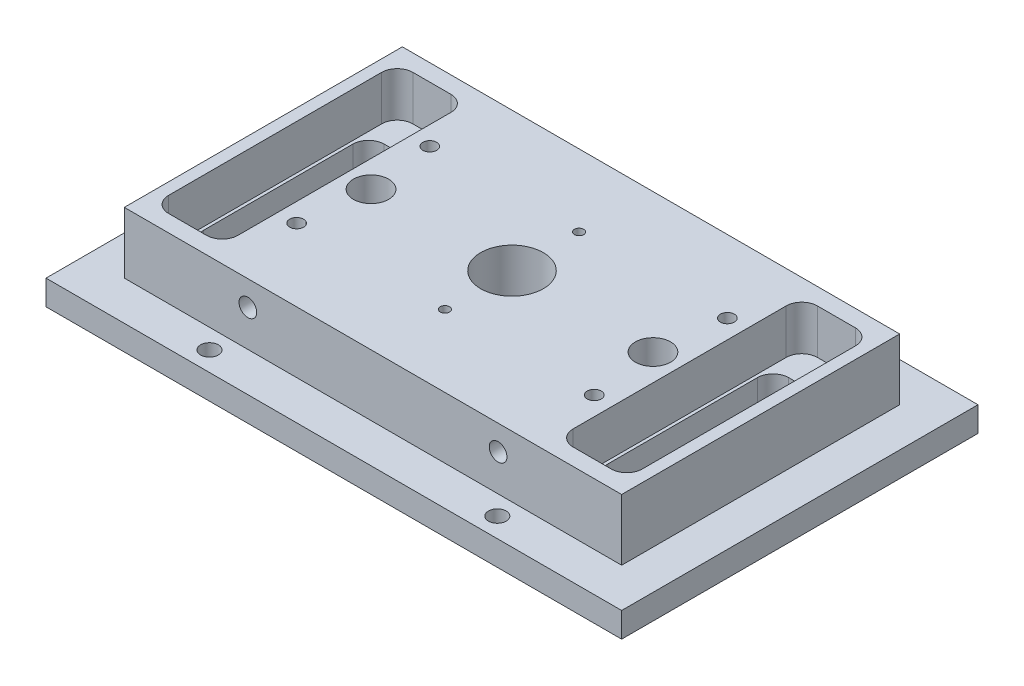
from build123d import *

# Parameters (mm, degrees)
MAIN_SKETCH_W                         = 73.5
MAIN_SKETCH_H                         = 45.5
MAIN_SKETCH_W_2                       = 8.85
MAIN_SKETCH_H_2                       = 31.2
MAIN_SKETCH_R                         = 2.2479
LIP_DEPTH                             = 3.175
MOUNTING_BASE_OUTLINE_W               = 63.5
MOUNTING_BASE_OUTLINE_H               = 35.5
MOUNTING_BASE_OUTLINE_R               = 2.2479
MOUNTING_BASE_OUTLINE_R_2             = 4
MOUNTING_BASE_DEPTH                   = 11
HEATER_CART_4_40_TAPS_D               = 2.2606
HEATER_CART_4_40_TAPS_DEPTH           = 7.595
HEATER_CART_4_40_TAPS_TIP             = 0.679152758
HEATER_CART_4_40_TAPS_ON_FACE_2_D     = 2.2606
HEATER_CART_4_40_TAPS_ON_FACE_2_DEPTH = 7.595
HEATER_CART_4_40_TAPS_ON_FACE_2_TIP   = 0.679152758
MAIN_SKETCH_12_W                      = 8.85
MAIN_SKETCH_12_H                      = 31.2
MAIN_SKETCH_12_R                      = 0.285
BOTTOM_SQUARE_CUTOUT_DEPTH            = 2
SQUARE_MICRO_D_CUTOUT_START           = 5.3
SQUARE_MICRO_D_CUTOUT_OUTLINE_W       = 8.85
SQUARE_MICRO_D_CUTOUT_OUTLINE_H       = 31.2
SQUARE_MICRO_D_CUTOUT_OUTLINE_R       = 0.285
SQUARE_MICRO_D_CUTOUT_DEPTH           = 5.7
SKETCH15_W                            = 8.067488146
SKETCH15_H                            = 23.070933647
CUT_EXTRUDE1_DEPTH                    = 11
INTERNAL_CORNER_CUTOUTS_FILLET_R      = 2
CHIP_CLAMP_0_80_TAPS_AT_2_COUNT       = 2
CHIP_CLAMP_0_80_TAPS_AT_2_PITCH       = 17.1232
CHIP_CLAMP_0_80_TAPS_AT_3_COUNT       = 2
CHIP_CLAMP_0_80_TAPS_AT_3_PITCH       = 17.1232
F_2_56_CLOSE_CLEAR_43_0_089_D         = 2.2606
PCB_2_56_TAPS_D                       = 1.778
PCB_2_56_TAPS_DEPTH                   = 5.734
PCB_2_56_TAPS_TIP                     = 0.53416509
BOTTOM_COVER_2_56_TAPS_D              = 1.778
BOTTOM_COVER_2_56_TAPS_DEPTH          = 5.734
BOTTOM_COVER_2_56_TAPS_TIP            = 0.53416509
F_2_56_TAPPED_HOLE1_D                 = 1.778
F_2_56_TAPPED_HOLE1_DEPTH             = 5.734
F_2_56_TAPPED_HOLE1_TIP               = 0.53416509


# Read off the part's stored shape, not the designer's step: Mounting_Base, Square_Micro_D_Cutout
with BuildPart() as part:
    # Main_Sketch → Lip (new body)
    with BuildSketch(Plane(origin=(0, 0, 0), x_dir=(1, 0, 0), z_dir=(0, 1, 0))):
        with Locations((36.75, -22.75)):
            Rectangle(MAIN_SKETCH_W, MAIN_SKETCH_H)
        with Locations((10.925, -22.749999985)):
            Rectangle(MAIN_SKETCH_W_2, MAIN_SKETCH_H_2, mode=Mode.SUBTRACT)
        with Locations(Location((18.75, -22.75, 0), (0, 0, 270))):
            Circle(MAIN_SKETCH_R, mode=Mode.SUBTRACT)
        with BuildLine():
            ThreePointArc((31.675, -20.175), (29.907233047, -15.907233047), (34.175, -17.675))
            Line((34.175, -17.675), (39.325, -17.675))
            ThreePointArc((39.325, -17.675), (43.592766953, -15.907233047), (41.825, -20.175))
            Line((41.825, -20.175), (41.825, -25.325))
            ThreePointArc((41.825, -25.325), (43.592766953, -29.592766953), (39.325, -27.825))
            Line((39.325, -27.825), (34.175, -27.825))
            ThreePointArc((34.175, -27.825), (29.907233047, -29.592766953), (31.675, -25.325))
            Line((31.675, -25.325), (31.675, -20.175))
        make_face(mode=Mode.SUBTRACT)
        with Locations(Location((54.75, -22.75, 0), (0, 0, 270))):
            Circle(MAIN_SKETCH_R, mode=Mode.SUBTRACT)
    extrude(amount=LIP_DEPTH)

    # Mounting_Base outline → Mounting_Base (add)
    with BuildSketch(Plane(origin=(0, 0, 0), x_dir=(1, 0, 0), z_dir=(0, 1, 0))):
        with Locations((36.75, -22.75)):
            Rectangle(MOUNTING_BASE_OUTLINE_W, MOUNTING_BASE_OUTLINE_H)
        with Locations((18.75, -22.75)):
            Circle(MOUNTING_BASE_OUTLINE_R, mode=Mode.SUBTRACT)
        with Locations((54.75, -22.75)):
            Circle(MOUNTING_BASE_OUTLINE_R, mode=Mode.SUBTRACT)
        with Locations((36.75, -22.75)):
            Circle(MOUNTING_BASE_OUTLINE_R_2, mode=Mode.SUBTRACT)
    extrude(amount=MOUNTING_BASE_DEPTH)

    # Heater_Cart_#4-40_Taps
    with Locations(Plane(origin=(52.725, 7.825, 5), x_dir=(-1, 0, 0), z_dir=(0, 0, -1))):
        with Locations((0, 0), (31.95, 0)):
            Hole(HEATER_CART_4_40_TAPS_D / 2, depth=HEATER_CART_4_40_TAPS_DEPTH)
            with Locations((0, 0, -(HEATER_CART_4_40_TAPS_DEPTH + HEATER_CART_4_40_TAPS_TIP / 2))):  # 118° drill point
                Cone(0, HEATER_CART_4_40_TAPS_D / 2, HEATER_CART_4_40_TAPS_TIP, mode=Mode.SUBTRACT)

    # Heater_Cart_#4-40_Taps on face 2
    with Locations(Plane(origin=(20.775, 7.825, 40.5), x_dir=(1, 0, 0), z_dir=(0, 0, 1))):
        with Locations((0, 0), (31.95, 0)):
            Hole(HEATER_CART_4_40_TAPS_ON_FACE_2_D / 2, depth=HEATER_CART_4_40_TAPS_ON_FACE_2_DEPTH)
            with Locations((0, 0, -(HEATER_CART_4_40_TAPS_ON_FACE_2_DEPTH + HEATER_CART_4_40_TAPS_ON_FACE_2_TIP / 2))):  # 118° drill point
                Cone(0, HEATER_CART_4_40_TAPS_ON_FACE_2_D / 2, HEATER_CART_4_40_TAPS_ON_FACE_2_TIP, mode=Mode.SUBTRACT)

    # Main_Sketch<12> → Bottom_square_cutout (cut)
    # profile 1 of 2: a face of its own
    with BuildSketch(Plane(origin=(0, 0, 0), x_dir=(1, 0, 0), z_dir=(0, 1, 0))):
        with Locations((10.925, -22.749999985)):
            Rectangle(MAIN_SKETCH_12_W, MAIN_SKETCH_12_H)
        with BuildLine():
            ThreePointArc((10.385689992, -35.285466808), (9.155254643, -35.471894814), (7.986136174, -35.045410869))
            ThreePointArc((7.986136174, -35.045410869), (7.18175843, -34.143309058), (6.891255927, -32.970099985))
            Line((6.891255927, -32.970099985), (6.891255927, -12.529899985))
            ThreePointArc((6.891255927, -12.529899985), (7.18175845, -11.356690961), (7.986136174, -10.454589189))
            ThreePointArc((7.986136174, -10.454589189), (9.155254643, -10.028105244), (10.385689992, -10.21453325))
            Line((10.385689992, -10.21453325), (13.424612074, -11.500982853))
            ThreePointArc((13.424612074, -11.500982853), (14.540409069, -12.427601581), (14.958744073, -13.816349588))
            Line((14.958744073, -13.816349588), (14.958744073, -31.683650456))
            ThreePointArc((14.958744073, -31.683650456), (14.540409073, -33.072398471), (13.424612074, -33.999017205))
            Line((13.424612074, -33.999017205), (10.385689992, -35.285466808))
        make_face(mode=Mode.SUBTRACT)
    # profile 2 of 2: a face of its own
    with BuildSketch(Plane(origin=(0, 0, 0), x_dir=(1, 0, 0), z_dir=(0, 1, 0))):
        with BuildLine():
            ThreePointArc((7.986136174, -35.045410869), (7.18175843, -34.143309058), (6.891255927, -32.970099985))
            Line((6.891255927, -32.970099985), (6.891255927, -12.529899985))
            ThreePointArc((6.891255927, -12.529899985), (7.18175845, -11.356690961), (7.986136174, -10.454589189))
            ThreePointArc((7.986136174, -10.454589189), (9.155254643, -10.028105244), (10.385689992, -10.21453325))
            Line((10.385689992, -10.21453325), (13.424612074, -11.500982853))
            ThreePointArc((13.424612074, -11.500982853), (14.540409069, -12.427601581), (14.958744073, -13.816349588))
            Line((14.958744073, -13.816349588), (14.958744073, -31.683650456))
            ThreePointArc((14.958744073, -31.683650456), (14.540409073, -33.072398471), (13.424612074, -33.999017205))
            Line((13.424612074, -33.999017205), (10.385689992, -35.285466808))
            ThreePointArc((10.385689992, -35.285466808), (9.155254643, -35.471894814), (7.986136174, -35.045410869))
        make_face()
        with Locations(Location((10.239255927, -22.75, 0), (0, 0, 270))):
            Circle(MAIN_SKETCH_12_R, mode=Mode.SUBTRACT)
    bottom_square_cutout = extrude(amount=BOTTOM_SQUARE_CUTOUT_DEPTH, mode=Mode.SUBTRACT)

    # Square_Micro_D_Cutout outline → Square_Micro_D_Cutout (cut)
    with BuildSketch(Plane(origin=(0, 0, 0), x_dir=(1, 0, 0), z_dir=(0, 1, 0)).offset(SQUARE_MICRO_D_CUTOUT_START)):
        with Locations((10.925, -22.749999985)):
            Rectangle(SQUARE_MICRO_D_CUTOUT_OUTLINE_W, SQUARE_MICRO_D_CUTOUT_OUTLINE_H)
        with Locations((10.239255927, -22.75)):
            Circle(SQUARE_MICRO_D_CUTOUT_OUTLINE_R, mode=Mode.SUBTRACT)
    square_micro_d_cutout = extrude(amount=SQUARE_MICRO_D_CUTOUT_DEPTH, mode=Mode.SUBTRACT)

    # Sketch15 → Cut-Extrude1 (cut)
    with BuildSketch(Plane(origin=(0, 0, 0), x_dir=(1, 0, 0), z_dir=(0, 1, 0))):
        with Locations((10.925, -22.749999985)):
            Rectangle(SKETCH15_W, SKETCH15_H)
    cut_extrude1 = extrude(amount=CUT_EXTRUDE1_DEPTH, mode=Mode.SUBTRACT)

    # MicroD_Mirror: Bottom_square_cutout, Square_Micro_D_Cutout, Cut-Extrude1 across plane
    add(bottom_square_cutout.mirror(Plane(origin=(36.75, 0, 0), x_dir=(0, 0, 1), z_dir=(1, 0, 0))), mode=Mode.SUBTRACT)
    add(square_micro_d_cutout.mirror(Plane(origin=(36.75, 0, 0), x_dir=(0, 0, 1), z_dir=(1, 0, 0))), mode=Mode.SUBTRACT)
    add(cut_extrude1.mirror(Plane(origin=(36.75, 0, 0), x_dir=(0, 0, 1), z_dir=(1, 0, 0))), mode=Mode.SUBTRACT)

    # Internal_Corner_cutouts_fillet
    internal_corner_cutouts_fillet_edges = [part.edges().sort_by_distance(p)[0] for p in [
        (15.35, 1, 38.349999985),
        (15.35, 1, 7.149999985),
        (6.5, 1, 7.149999985),
        (6.5, 1, 38.349999985),
        (15.35, 8.15, 38.349999985),
        (6.5, 8.15, 38.349999985),
        (6.5, 8.15, 7.149999985),
        (15.35, 8.15, 7.149999985),
        (14.958744073, 3.65, 34.285466808),
        (14.958744073, 3.65, 11.214533161),
        (6.891255927, 3.65, 11.214533161),
        (6.891255927, 3.65, 34.285466808),
        (58.15, 1, 7.149999985),
        (58.15, 1, 38.349999985),
        (67, 1, 38.349999985),
        (67, 1, 7.149999985),
        (67, 8.15, 7.149999985),
        (67, 8.15, 38.349999985),
        (58.15, 8.15, 38.349999985),
        (58.15, 8.15, 7.149999985),
        (58.541255927, 3.65, 11.214533161),
        (58.541255927, 3.65, 34.285466808),
        (66.608744073, 3.65, 34.285466808),
        (66.608744073, 3.65, 11.214533161),
    ]]
    fillet(internal_corner_cutouts_fillet_edges, radius=INTERNAL_CORNER_CUTOUTS_FILLET_R)

    # Sketch3 → Chip_Clamp_#0-80 Taps (revolve, cut)
    with BuildSketch(Plane(origin=(36.75, 11, 31.3116), x_dir=(0, 0, 1), z_dir=(1, 0, 0))):
        Polygon((0, 0), (0, 4.358890611), (0.59563, 4.001), (0.59563, 0), align=None)
    chip_clamp_0_80_taps = revolve(axis=Axis((36.75, 17.35, 31.3116), (0, -1, 0)), mode=Mode.SUBTRACT)

    # Chip_Clamp_#0-80 Taps at 2: Chip_Clamp_#0-80 Taps ×2
    with Locations(*[(0, 0, -i * CHIP_CLAMP_0_80_TAPS_AT_2_PITCH) for i in range(1, CHIP_CLAMP_0_80_TAPS_AT_2_COUNT)]):
        add(chip_clamp_0_80_taps, mode=Mode.SUBTRACT)

    # Chip_Clamp_#0-80 Taps at 3: Chip_Clamp_#0-80 Taps ×2
    with Locations(*[(0, 0, -i * CHIP_CLAMP_0_80_TAPS_AT_3_PITCH) for i in range(1, CHIP_CLAMP_0_80_TAPS_AT_3_COUNT)]):
        add(chip_clamp_0_80_taps, mode=Mode.SUBTRACT)

    # 2-56_Close_Clear#43 (0.089) (through all)
    with Locations(Plane(origin=(18.375, 0, 43), x_dir=(0, 0, -1), z_dir=(0, -1, 0))):
        with Locations((0, 0), (40.5, 0), (40.5, 36.75), (0, 36.75)):
            Hole(F_2_56_CLOSE_CLEAR_43_0_089_D / 2)

    # PCB #2-56 Taps
    with Locations(Plane(origin=(17.75, 11, 14.25), x_dir=(0, 0, 1), z_dir=(0, 1, 0))):
        with Locations((0, 0), (17, 0), (0, 38), (17, 38)):
            Hole(PCB_2_56_TAPS_D / 2, depth=PCB_2_56_TAPS_DEPTH)
            with Locations((0, 0, -(PCB_2_56_TAPS_DEPTH + PCB_2_56_TAPS_TIP / 2))):  # 118° drill point
                Cone(0, PCB_2_56_TAPS_D / 2, PCB_2_56_TAPS_TIP, mode=Mode.SUBTRACT)

    # Bottom_Cover#2-56 Taps
    with Locations(Plane(origin=(54.75, 0, 18.75), x_dir=(0, 0, -1), z_dir=(0, -1, 0))):
        with Locations((0, 0), (-8, 0), (-8, -36), (0, -36)):
            Hole(BOTTOM_COVER_2_56_TAPS_D / 2, depth=BOTTOM_COVER_2_56_TAPS_DEPTH)
            with Locations((0, 0, -(BOTTOM_COVER_2_56_TAPS_DEPTH + BOTTOM_COVER_2_56_TAPS_TIP / 2))):  # 118° drill point
                Cone(0, BOTTOM_COVER_2_56_TAPS_D / 2, BOTTOM_COVER_2_56_TAPS_TIP, mode=Mode.SUBTRACT)

    # #2-56 Tapped Hole1
    with Locations(Plane(origin=(32.94, 0, 31.38), x_dir=(0, 0, -1), z_dir=(0, -1, 0))):
        with Locations((0, 0), (-7.62, 0), (-7.62, 7.62), (0, 7.62)):
            Hole(F_2_56_TAPPED_HOLE1_D / 2, depth=F_2_56_TAPPED_HOLE1_DEPTH)
            with Locations((0, 0, -(F_2_56_TAPPED_HOLE1_DEPTH + F_2_56_TAPPED_HOLE1_TIP / 2))):  # 118° drill point
                Cone(0, F_2_56_TAPPED_HOLE1_D / 2, F_2_56_TAPPED_HOLE1_TIP, mode=Mode.SUBTRACT)


solid = part.part
